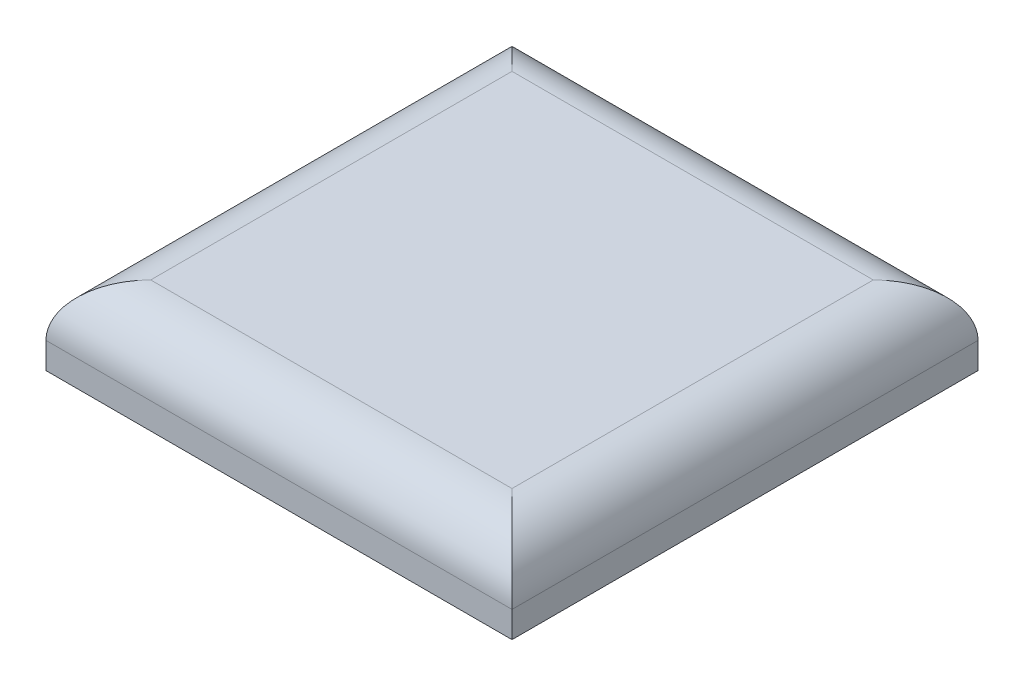
from build123d import *

# Parameters (mm, degrees)
SKETCH_1_W      = 17.8
SKETCH_1_H      = 17.8
EXTRUDE_1_DEPTH = 3
FILLET_1_R      = 2


with BuildPart() as part:
    # Эскиз1 → Бобышка-Вытянуть1 (new body)
    with BuildSketch(Plane(origin=(0, 0, 0), x_dir=(1, 0, 0), z_dir=(0, 1, 0))):
        Rectangle(SKETCH_1_W, SKETCH_1_H)
    extrude(amount=EXTRUDE_1_DEPTH)

    # Скругление1
    fillet_1_edges = [part.edges().sort_by_distance(p)[0] for p in [
        (8.9, 3, 0),
        (0, 3, -8.9),
        (-8.9, 3, 0),
        (0, 3, 8.9),
    ]]
    fillet(fillet_1_edges, radius=FILLET_1_R)


solid = part.part
